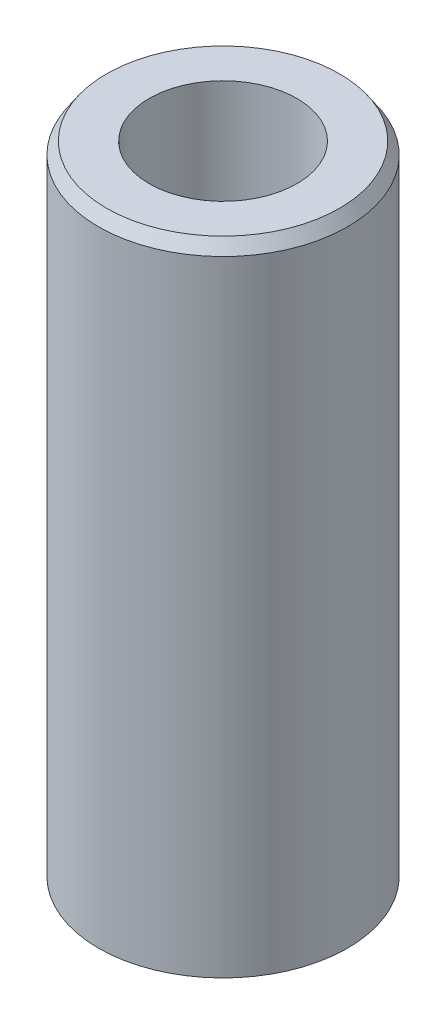
from build123d import *
from OCP.BRepFilletAPI import BRepFilletAPI_MakeChamfer

# Parameters (mm, degrees)
SKETCH1_R           = 32.5
BOSS_EXTRUDE1_DEPTH = 168.236509866
SKETCH2_R           = 19.273979557
CUT_EXTRUDE1_DEPTH  = 175.401901515
CHAMFER1_SIZE       = 3.124682069
CHAMFER1_SIZE2      = 2.10651667


with BuildPart() as part:
    # Sketch1 → Boss-Extrude1 (new body)
    with BuildSketch(Plane(origin=(0, 0, 0), x_dir=(1, 0, 0), z_dir=(0, 1, 0))):
        Circle(SKETCH1_R)
    extrude(amount=BOSS_EXTRUDE1_DEPTH)

    # Sketch2 → Cut-Extrude1 (cut, through all)
    with BuildSketch(Plane(origin=(0, 0, 0), x_dir=(1, 0, 0), z_dir=(0, 1, 0))):
        Circle(SKETCH2_R)
    extrude(amount=CUT_EXTRUDE1_DEPTH, mode=Mode.SUBTRACT)

    # Chamfer1: one chamfer whose edges measure the first distance from different faces: ONE call of the kernel's chamfer builder (chamfer() names one face for all edges)
    chamfer1_edges_1 = [part.edges().sort_by_distance(p)[0] for p in [
        (-32.5, 168.236509866, 0),
    ]]
    chamfer1_side_1 = [part.faces().sort_by_distance(p)[0] for p in [
        (-32.5, 84.118254933, 0),
    ]]
    chamfer1_edges_2 = [part.edges().sort_by_distance(p)[0] for p in [
        (-32.5, 0, 0),
    ]]
    chamfer1_side_2 = [part.faces().sort_by_distance(p)[0] for p in [
        (-31.580761184, 0, 0),
    ]]
    chamfer1 = BRepFilletAPI_MakeChamfer(part.part.solid().wrapped)
    for e in chamfer1_edges_1:
        chamfer1.Add(CHAMFER1_SIZE, CHAMFER1_SIZE2, e.wrapped, chamfer1_side_1[0].wrapped)  # the first distance lies on this face
    for e in chamfer1_edges_2:
        chamfer1.Add(CHAMFER1_SIZE, CHAMFER1_SIZE2, e.wrapped, chamfer1_side_2[0].wrapped)  # the first distance lies on this face
    add(Compound.cast(chamfer1.Shape()), mode=Mode.REPLACE)


solid = part.part
